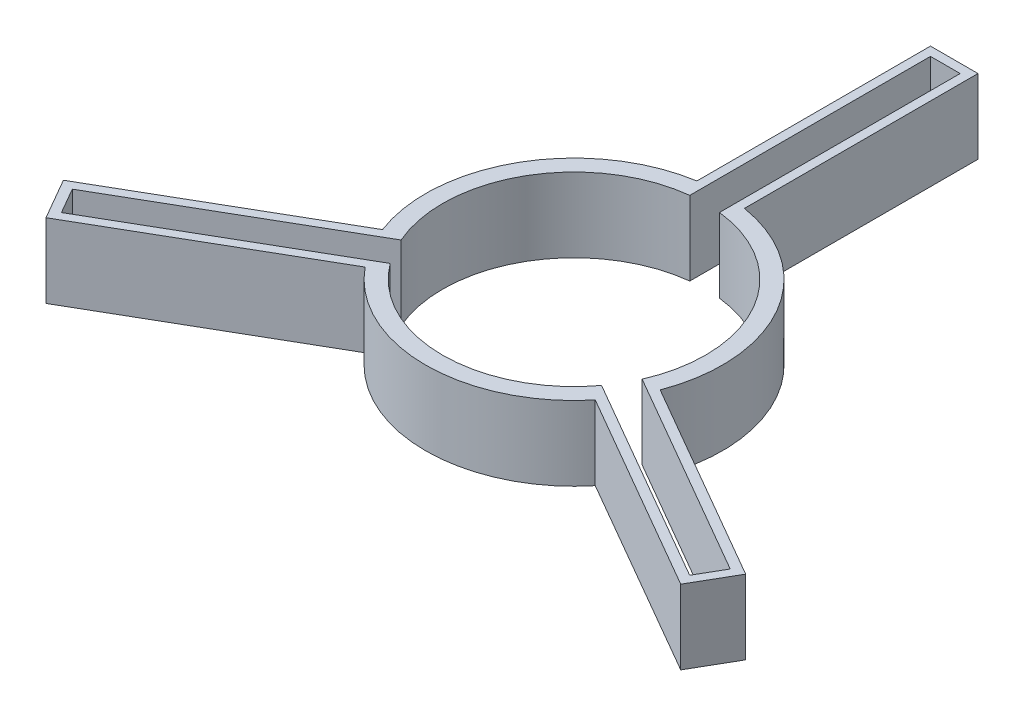
from build123d import *

# Parameters (mm, degrees)
BOSS_EXTRUDE1_DEPTH = 10


with BuildPart() as part:
    # Sketch1 → Boss-Extrude1 (new body)
    with BuildSketch(Plane(origin=(0, 0, 0), x_dir=(1, 0, 0), z_dir=(0, 1, 0))):
        with BuildLine():
            ThreePointArc((-3.2, 19.742340287), (-17.320508076, 10), (-18.697368219, -7.099888851))
            Line((-18.697368219, -7.099888851), (-45.940500674, -22.828718708))
            Line((-45.940500674, -22.828718708), (-42.740500674, -28.371281292))
            Line((-42.740500674, -28.371281292), (-15.497368219, -12.642451436))
            ThreePointArc((-15.497368219, -12.642451436), (0, -20), (15.497368219, -12.642451436))
            Line((15.497368219, -12.642451436), (42.740500674, -28.371281292))
            Line((42.740500674, -28.371281292), (45.940500674, -22.828718708))
            Line((45.940500674, -22.828718708), (18.697368219, -7.099888851))
            ThreePointArc((18.697368219, -7.099888851), (17.320508076, 10), (3.2, 19.742340287))
            Line((3.2, 19.742340287), (3.2, 51.2))
            Line((3.2, 51.2), (-3.2, 51.2))
            Line((-3.2, 51.2), (-3.2, 19.742340287))
        make_face()
        with BuildLine():
            ThreePointArc((-16.23047931, -7.061270522), (-15.328649647, 8.85), (-2, 17.586642659))
            Line((-2, 17.586642659), (-2, 50))
            Line((-2, 50), (2, 50))
            Line((2, 50), (2, 17.586642659))
            ThreePointArc((2, 17.586642659), (15.328649647, 8.85), (16.23047931, -7.061270522))
            Line((16.23047931, -7.061270522), (44.301270189, -23.267949192))
            Line((44.301270189, -23.267949192), (42.301270189, -26.732050808))
            Line((42.301270189, -26.732050808), (14.23047931, -10.525372137))
            ThreePointArc((14.23047931, -10.525372137), (0, -17.7), (-14.23047931, -10.525372137))
            Line((-14.23047931, -10.525372137), (-42.301270189, -26.732050808))
            Line((-42.301270189, -26.732050808), (-44.301270189, -23.267949192))
            Line((-44.301270189, -23.267949192), (-16.23047931, -7.061270522))
        make_face(mode=Mode.SUBTRACT)
    extrude(amount=BOSS_EXTRUDE1_DEPTH)


solid = part.part
